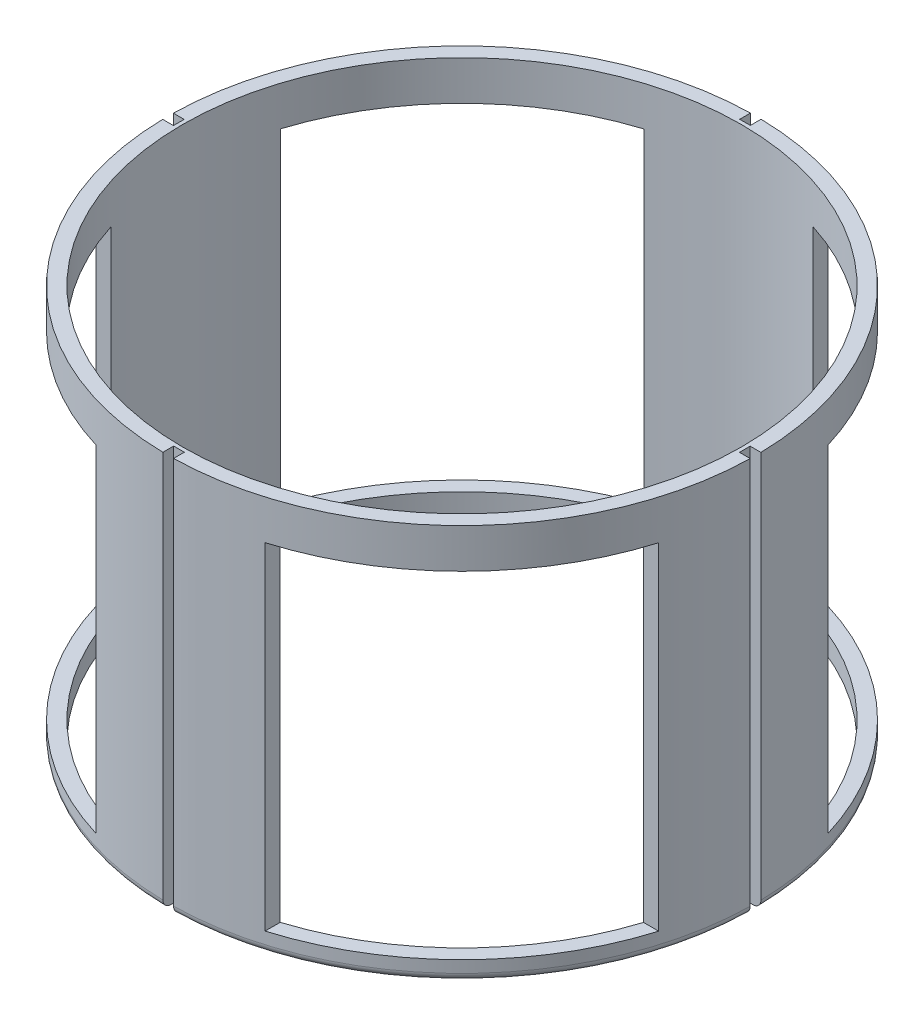
from build123d import *

# Parameters (mm, degrees)
SKETCH1_R           = 94.2975
SKETCH1_R_2         = 89.662
BOSS_EXTRUDE1_DEPTH = 127
SKETCH5_W           = 3.429
SKETCH5_H           = 5.08
SKETCH5_W_2         = 5.08
SKETCH5_H_2         = 3.429
CUT_EXTRUDE1_DEPTH  = 127
CUT_EXTRUDE2_START  = -12.7
CUT_EXTRUDE2_DEPTH  = 107.95
CIRPATTERN1_COUNT   = 4
FILLET1_R           = 2.54


with BuildPart() as part:
    # Sketch1 → Boss-Extrude1 (new body)
    with BuildSketch(Plane(origin=(0, 0, 0), x_dir=(1, 0, 0), z_dir=(0, 1, 0))):
        Circle(SKETCH1_R)
        Circle(SKETCH1_R_2, mode=Mode.SUBTRACT)
    extrude(amount=-BOSS_EXTRUDE1_DEPTH)

    # Sketch5 → Cut-Extrude1 (cut)
    with BuildSketch(Plane(origin=(0, 0, 0), x_dir=(1, 0, 0), z_dir=(0, 1, 0))):
        with Locations((0, 93.360875)):
            Rectangle(SKETCH5_W, SKETCH5_H)
        with Locations((0, -93.360875)):
            Rectangle(SKETCH5_W, SKETCH5_H)
        with Locations((-93.360875, -0.0635)):
            Rectangle(SKETCH5_W_2, SKETCH5_H_2)
        with Locations((93.360875, -0.0635)):
            Rectangle(SKETCH5_W_2, SKETCH5_H_2)
    extrude(amount=-CUT_EXTRUDE1_DEPTH, mode=Mode.SUBTRACT)

    # Sketch7 → Cut-Extrude2 (cut)
    with BuildSketch(Plane(origin=(0, 0, 0), x_dir=(1, 0, 0), z_dir=(0, 1, 0)).offset(CUT_EXTRUDE2_START)):
        with BuildLine():
            Line((85.443727447, -27.178), (90.296039903, -27.178))
            ThreePointArc((90.296039903, -27.178), (66.654954519, -66.701840637), (27.1145, -90.315128279))
            Line((27.1145, -90.315128279), (27.1145, -85.463899594))
            ThreePointArc((27.1145, -85.463899594), (63.377047615, -63.424160063), (85.443727447, -27.178))
        make_face()
    cut_extrude2 = extrude(amount=-CUT_EXTRUDE2_DEPTH, mode=Mode.SUBTRACT)

    # CirPattern1: Cut-Extrude2 ×4 about axis
    cirpattern1_axis = Axis((0, 0, 0), (0, 1, 0))
    for i in range(1, CIRPATTERN1_COUNT):
        add(cut_extrude2.rotate(cirpattern1_axis, i * 360 / CIRPATTERN1_COUNT), mode=Mode.SUBTRACT)

    # Fillet1
    fillet1_edges = [part.edges().sort_by_distance(p)[0] for p in [
        (-66.700852134, -127, -66.655943702),
        (-66.655943427, -127, 66.700852409),
        (66.700852134, -127, -66.655943702),
        (66.655943427, -127, 66.700852409),
    ]]
    fillet(fillet1_edges, radius=FILLET1_R)


solid = part.part
